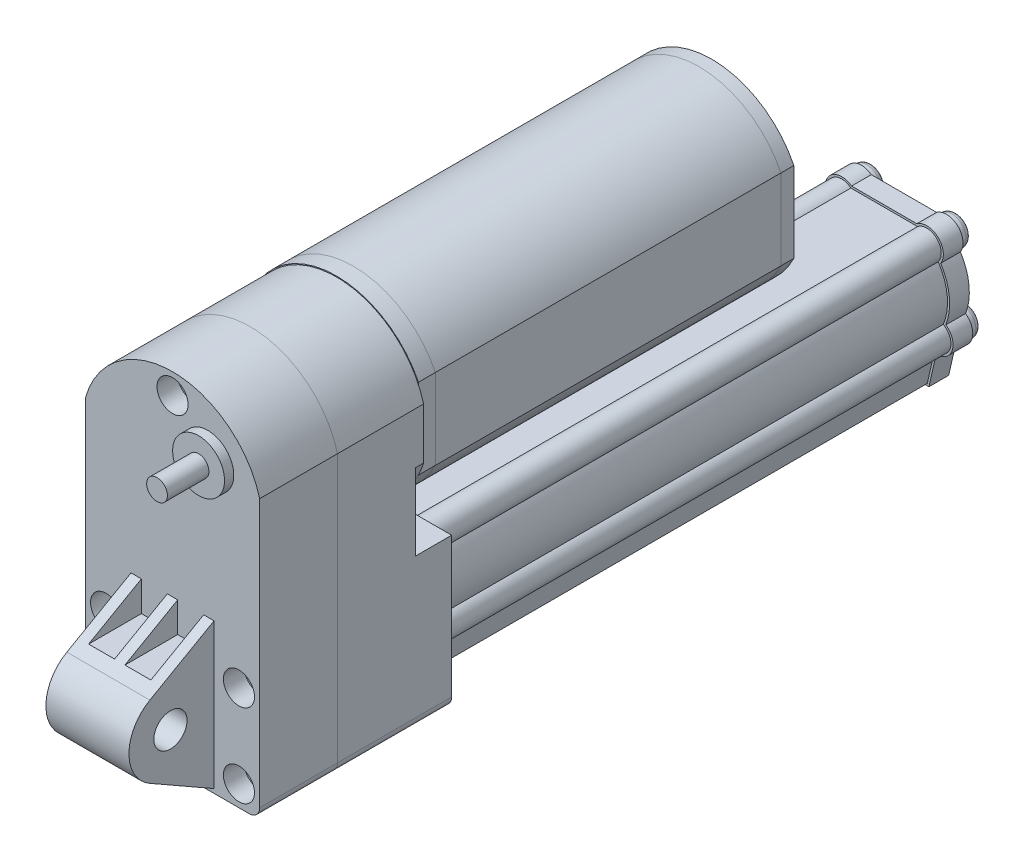
from build123d import *

# Parameters (mm, degrees)
BOSS_EXTRUDE1_DEPTH  = 19.05
SKETCH6_R            = 3.81
CUT_EXTRUDE2_DEPTH   = 5.08
SKETCH12_R           = 3.81
CUT_EXTRUDE3_DEPTH   = 5.08
BOSS_EXTRUDE11_DEPTH = 27.94
CUT_EXTRUDE4_DEPTH   = 8.89
CUT_EXTRUDE5_START   = -6.858
CUT_EXTRUDE5_DEPTH   = 6.858
BOSS_EXTRUDE13_DEPTH = 4.1402
BOSS_EXTRUDE14_DEPTH = 84.582
BOSS_EXTRUDE16_DEPTH = 3.1496
SKETCH26_R           = 11.938
BOSS_EXTRUDE17_DEPTH = 2.54
SKETCH27_R           = 11.938
BOSS_EXTRUDE20_DEPTH = 3.429
CHAMFER1_SIZE        = 2.286
FILLET11_R           = 2.54
CUT_EXTRUDE6_START   = -2.794
CUT_EXTRUDE6_DEPTH   = 2.794
BOSS_EXTRUDE21_DEPTH = 130
BOSS_EXTRUDE23_DEPTH = 4.826
SKETCH32_R           = 9.398
BOSS_EXTRUDE24_DEPTH = 8.128
SKETCH43_R           = 3.556
BOSS_EXTRUDE26_DEPTH = 2.54
FILLET13_R           = 1.27
SKETCH44_R           = 6.35
BOSS_EXTRUDE27_DEPTH = 2.2606
SKETCH45_R           = 2.54
BOSS_EXTRUDE28_DEPTH = 10.16
BOSS_EXTRUDE29_START = -11.176
SKETCH3_R            = 4.064
BOSS_EXTRUDE29_DEPTH = 20.32
SKETCH46_W           = 6.35
SKETCH46_H           = 7.366
CUT_EXTRUDE9_DEPTH   = 20.32
MOVE_START           = -1.75482957
MOVE_FACE1_DEPTH     = 20.32
MOVE_START_2         = 0.78517043
MOVE_FACE1_2_DEPTH   = 6.35
MOVE_START_3         = 9.67517043
MOVE_FACE1_3_DEPTH   = 6.35
MOVE_FACE1_4_DEPTH   = 20.32
MOVE_FACE1_5_DEPTH   = 2.54
MOVE_START_4         = 7.13517043
MOVE_FACE1_6_DEPTH   = 2.54
MOVE_START_5         = 16.02517043
MOVE_FACE1_7_DEPTH   = 2.54
FILLET14_R           = 2.54
FILLET15_R           = 2.54
SKETCH34_R           = 9.398
CUT_EXTRUDE11_DEPTH  = 185.928


# Read off the part's stored shape, not the designer's step: Cut-Extrude6, Move Face1
with BuildPart() as part:
    # Sketch1 → Boss-Extrude1 (new body)
    with BuildSketch(Plane.XY):
        with BuildLine():
            Line((-12.93082957, -18.491086285), (29.74117043, -18.491086285))
            Line((29.74117043, -18.491086285), (29.74117043, 49.580913715))
            ThreePointArc((29.74117043, 49.580913715), (8.40517043, 65.836892729), (-12.93082957, 49.580913715))
            Line((-12.93082957, 49.580913715), (-12.93082957, -18.491086285))
        make_face()
    extrude(amount=-BOSS_EXTRUDE1_DEPTH)

    # Sketch6 → Cut-Extrude2 (cut)
    with BuildSketch(Plane.XY):
        with Locations((-7.85082957, 6.908913715)):
            Circle(SKETCH6_R)
        with Locations((-7.85082957, -13.411086285)):
            Circle(SKETCH6_R)
        with Locations((24.66117043, 6.908913715)):
            Circle(SKETCH6_R)
        with Locations((24.66117043, -13.411086285)):
            Circle(SKETCH6_R)
    extrude(amount=-CUT_EXTRUDE2_DEPTH, mode=Mode.SUBTRACT)

    # Sketch12 → Cut-Extrude3 (cut)
    with BuildSketch(Plane.XY):
        with Locations((8.40517043, 60.756892729)):
            Circle(SKETCH12_R)
    extrude(amount=-CUT_EXTRUDE3_DEPTH, mode=Mode.SUBTRACT)

    # Sketch44 → Boss-Extrude27 (add)
    with BuildSketch(Plane.XY):
        with Locations(Location((17.04117043, 51.358913715, 0), (0, 0, 180))):
            Circle(SKETCH44_R)
    extrude(amount=BOSS_EXTRUDE27_DEPTH)

    # Sketch45 → Boss-Extrude28 (add)
    with BuildSketch(Plane.XY.offset(2.2606)):
        with Locations((17.04117043, 51.358913715)):
            Circle(SKETCH45_R)
    extrude(amount=BOSS_EXTRUDE28_DEPTH)

    # Sketch3 → Boss-Extrude29 (add)
    with BuildSketch(Plane.ZY.offset(12.93082957).offset(BOSS_EXTRUDE29_START)):
        with BuildLine():
            Line((0, -16.662286285), (0, 1.117779576))
            Line((0, 1.117779576), (0, 18.897713715))
            Line((0, 18.897713715), (15.701246407, 9.943459406))
            ThreePointArc((15.701246407, 9.943459406), (20.828056876, 1.117811735), (15.701302277, -7.70786839))
            Line((15.701302277, -7.70786839), (0, -16.662286285))
        make_face()
        with Locations((10.668054799, 1.117779576)):
            Circle(SKETCH3_R, mode=Mode.SUBTRACT)
    extrude(amount=-BOSS_EXTRUDE29_DEPTH)

    # Sketch46 → Cut-Extrude9 (cut)
    with BuildSketch(Plane.XY):
        with Locations((3.96017043, 15.214713715)):
            Rectangle(SKETCH46_W, SKETCH46_H)
        with Locations((12.85017043, 15.214713715)):
            Rectangle(SKETCH46_W, SKETCH46_H)
        with Locations((3.96017043, -12.979286285)):
            Rectangle(SKETCH46_W, SKETCH46_H)
        with Locations((12.85017043, -12.979286285)):
            Rectangle(SKETCH46_W, SKETCH46_H)
    extrude(amount=CUT_EXTRUDE9_DEPTH, mode=Mode.SUBTRACT)

    # Move Face1 outline → Move Face1 (cut)
    with BuildSketch(Plane.YZ.offset(MOVE_START)):
        with BuildLine():
            Line((9.140819406, 15.701246407), (18.095073715, 0))
            Line((18.095073715, 0), (18.897713715, 0))
            Line((18.897713715, 0), (9.943459406, 15.701246407))
            ThreePointArc((9.943459406, 15.701246407), (6.046592425, 19.552448201), (0.716459577, 20.820127714))
            ThreePointArc((0.716459577, 20.820127714), (5.591039303, 19.350826493), (9.140819406, 15.701246407))
        make_face()
        with BuildLine():
            ThreePointArc((0.716459576, 6.623918518), (-2.946220424, 10.668054799), (0.716459576, 14.71219108))
            ThreePointArc((0.716459576, 14.71219108), (-3.748860424, 10.668054799), (0.716459576, 6.623918518))
        make_face()
    extrude(amount=MOVE_FACE1_DEPTH, mode=Mode.SUBTRACT)

    # Move Face1 2 outline → Move Face1 2 (cut)
    with BuildSketch(Plane.YZ.offset(MOVE_START_2)):
        Polygon((11.531713715, 11.508823522), (10.729073716, 12.916249308), (10.729073715, 0), (11.531713715, 0), align=None)
    extrude(amount=MOVE_FACE1_2_DEPTH, mode=Mode.SUBTRACT)

    # Move Face1 3 outline → Move Face1 3 (cut)
    with BuildSketch(Plane.YZ.offset(MOVE_START_3)):
        Polygon((11.531713715, 11.508823522), (10.729073716, 12.916249308), (10.729073715, 0), (11.531713715, 0), align=None)
    extrude(amount=MOVE_FACE1_3_DEPTH, mode=Mode.SUBTRACT)

    # Move Face1 4 outline → Move Face1 4 (add)
    with BuildSketch(Plane.YZ.offset(MOVE_START)):
        with BuildLine():
            ThreePointArc((-7.70786839, 15.701302277), (-4.158092666, 19.350843192), (0.716459577, 20.820127714))
            ThreePointArc((0.716459577, 20.820127714), (-4.61364515, 19.552463801), (-8.51050839, 15.701302277))
            Line((-8.51050839, 15.701302277), (-10.098926285, 12.916059306))
            Line((-10.098926285, 12.916059306), (-10.098926285, 0))
            Line((-10.098926285, 0), (-9.296286285, 0))
            Line((-9.296286285, 0), (-9.296286285, 12.916059306))
            Line((-9.296286285, 12.916059306), (-7.70786839, 15.701302277))
        make_face()
        with BuildLine():
            ThreePointArc((0.716459576, 14.71219108), (4.379139576, 10.668054799), (0.716459576, 6.623918518))
            ThreePointArc((0.716459576, 6.623918518), (5.181779576, 10.668054799), (0.716459576, 14.71219108))
        make_face()
    extrude(amount=MOVE_FACE1_4_DEPTH)

    # Move Face1 5 outline → Move Face1 5 (add)
    with BuildSketch(Plane.YZ.offset(MOVE_START)):
        Polygon((-10.098926285, 11.508654222), (-10.098926285, 12.916059306), (-17.464926285, 0), (-16.662286285, 0), align=None)
    extrude(amount=MOVE_FACE1_5_DEPTH)

    # Move Face1 6 outline → Move Face1 6 (add)
    with BuildSketch(Plane.YZ.offset(MOVE_START_4)):
        Polygon((-10.098926285, 11.508654222), (-10.098926285, 12.916059306), (-17.464926285, 0), (-16.662286285, 0), align=None)
    extrude(amount=MOVE_FACE1_6_DEPTH)

    # Move Face1 7 outline → Move Face1 7 (add)
    with BuildSketch(Plane.YZ.offset(MOVE_START_5)):
        Polygon((-10.098926285, 11.508654222), (-10.098926285, 12.916059306), (-17.464926285, 0), (-16.662286285, 0), align=None)
    extrude(amount=MOVE_FACE1_7_DEPTH)

    # Fillet14
    fillet14_edges = [part.edges().sort_by_distance(p)[0] for p in [
        (29.74117043, -18.491086285, -9.525),
        (-12.93082957, -18.491086285, -9.525),
    ]]
    fillet(fillet14_edges, radius=FILLET14_R)


with BuildPart() as body_2:
    # Sketch17 → Boss-Extrude11 (new body)
    with BuildSketch(Plane(origin=(0, 0, -19.05), x_dir=(-1, 0, 0), z_dir=(0, 0, -1))):
        with BuildLine():
            Line((12.93082957, -18.491086285), (-29.74117043, -18.491086285))
            Line((-29.74117043, -18.491086285), (-29.74117043, 49.580913715))
            ThreePointArc((-29.74117043, 49.580913715), (-8.40517043, 65.836892729), (12.93082957, 49.580913715))
            Line((12.93082957, 49.580913715), (12.93082957, -18.491086285))
        make_face()
    extrude(amount=BOSS_EXTRUDE11_DEPTH)

    # Sketch18 → Cut-Extrude4 (cut)
    with BuildSketch(Plane(origin=(0, 0, -46.99), x_dir=(-1, 0, 0), z_dir=(0, 0, -1))):
        with BuildLine():
            Line((-29.74117043, 18.338913715), (12.93082957, 18.338913715))
            Line((12.93082957, 18.338913715), (12.93082957, 37.044777605))
            ThreePointArc((12.93082957, 37.044777605), (-8.40517043, 21.355135146), (-29.74117043, 37.044777605))
            Line((-29.74117043, 37.044777605), (-29.74117043, 18.338913715))
        make_face()
    extrude(amount=-CUT_EXTRUDE4_DEPTH, mode=Mode.SUBTRACT)

    # Sketch18<5> → Cut-Extrude5 (cut)
    with BuildSketch(Plane(origin=(0, 0, -46.99), x_dir=(-1, 0, 0), z_dir=(0, 0, -1)).offset(CUT_EXTRUDE5_START)):
        with BuildLine():
            Line((12.93082957, 49.580913715), (12.93082957, 37.044777605))
            ThreePointArc((12.93082957, 37.044777605), (13.691369751, 40.337444359), (13.94682957, 43.707135146))
            ThreePointArc((13.94682957, 43.707135146), (-11.774861217, 65.803675328), (-29.74117043, 37.044777605))
            Line((-29.74117043, 37.044777605), (-29.74117043, 49.580913715))
            ThreePointArc((-29.74117043, 49.580913715), (-8.40517043, 65.836892729), (12.93082957, 49.580913715))
        make_face()
        with BuildLine():
            ThreePointArc((-29.74117043, 37.044777605), (-8.40517043, 21.355135146), (12.93082957, 37.044777605))
            Line((12.93082957, 37.044777605), (12.93082957, 49.580913715))
            ThreePointArc((12.93082957, 49.580913715), (-8.40517043, 65.836892729), (-29.74117043, 49.580913715))
            Line((-29.74117043, 49.580913715), (-29.74117043, 37.044777605))
        make_face()
    extrude(amount=CUT_EXTRUDE5_DEPTH, mode=Mode.SUBTRACT)

    # Cut-Extrude6 outline → Cut-Extrude6 (cut)
    with BuildSketch(Plane(origin=(0, 0, -46.99), x_dir=(-1, 0, 0), z_dir=(0, 0, -1)).offset(CUT_EXTRUDE6_START)):
        with BuildLine():
            ThreePointArc((-16.567972961, 13.571054992), (-21.299133174, 13.349170074), (-21.61317043, 8.623232021))
            ThreePointArc((-21.61317043, 8.623232021), (-23.83485908, 2.454274355), (-22.858312088, -4.029420203))
            ThreePointArc((-22.858312088, -4.029420203), (-24.684009124, -7.803496663), (-21.646586083, -10.693286285))
            Line((-21.646586083, -10.693286285), (-20.72417043, -10.693286285))
            Line((-20.72417043, -10.693286285), (-18.94617043, -18.491086285))
            Line((-18.94617043, -18.491086285), (2.13582957, -18.491086285))
            Line((2.13582957, -18.491086285), (3.91382957, -10.693286285))
            ThreePointArc((3.91382957, -10.693286285), (7.761606127, -8.251890338), (6.047971228, -4.029420203))
            ThreePointArc((6.047971228, -4.029420203), (6.826033776, -1.49449173), (7.08882957, 1.144102983))
            Line((7.08882957, 1.144102983), (7.088819872, 1.160210788))
            ThreePointArc((7.088819872, 1.160210788), (6.502214683, 5.062148637), (4.80282957, 8.623232021))
            ThreePointArc((4.80282957, 8.623232021), (4.488792314, 13.349170074), (-0.242367899, 13.571054992))
            Line((-0.242367899, 13.571054992), (-16.567972961, 13.571054992))
        make_face()
    extrude(amount=CUT_EXTRUDE6_DEPTH, mode=Mode.SUBTRACT)

    # Fillet15
    fillet15_edges = [body_2.edges().sort_by_distance(p)[0] for p in [
        (-12.93082957, -18.491086285, -33.02),
        (29.74117043, -18.491086285, -33.02),
    ]]
    fillet(fillet15_edges, radius=FILLET15_R)


with BuildPart() as body_3:
    # Sketch23 → Boss-Extrude13 (new body)
    with BuildSketch(Plane(origin=(0, 0, -40.132), x_dir=(-1, 0, 0), z_dir=(0, 0, -1))):
        with BuildLine():
            Line((11.66082957, 43.707135146), (11.66082957, 33.859924983))
            ThreePointArc((11.66082957, 33.859924983), (-8.40517043, 21.355135146), (-28.47117043, 33.859924983))
            Line((-28.47117043, 33.859924983), (-28.47117043, 43.707135146))
            Line((-28.47117043, 43.707135146), (-28.47117043, 53.554345309))
            ThreePointArc((-28.47117043, 53.554345309), (-8.40517043, 66.059135146), (11.66082957, 53.554345309))
            Line((11.66082957, 53.554345309), (11.66082957, 43.707135146))
        make_face()
    extrude(amount=BOSS_EXTRUDE13_DEPTH)


with BuildPart() as body_4:
    # Sketch24 → Boss-Extrude14 (new body)
    with BuildSketch(Plane(origin=(0, 0, -44.2722), x_dir=(-1, 0, 0), z_dir=(0, 0, -1))):
        with BuildLine():
            Line((11.66082957, 33.859924983), (11.66082957, 53.554345309))
            ThreePointArc((11.66082957, 53.554345309), (-8.40517043, 66.059135146), (-28.47117043, 53.554345309))
            Line((-28.47117043, 53.554345309), (-28.47117043, 33.859924983))
            ThreePointArc((-28.47117043, 33.859924983), (-8.40517043, 21.355135146), (11.66082957, 33.859924983))
        make_face()
    extrude(amount=BOSS_EXTRUDE14_DEPTH)


with BuildPart() as body_5:
    # Sketch25 → Boss-Extrude16 (new body)
    with BuildSketch(Plane(origin=(0, 0, -128.8542), x_dir=(-1, 0, 0), z_dir=(0, 0, -1))):
        with BuildLine():
            Line((11.66082957, 33.859924983), (11.66082957, 53.554345309))
            ThreePointArc((11.66082957, 53.554345309), (-8.40517043, 66.059135146), (-28.47117043, 53.554345309))
            Line((-28.47117043, 53.554345309), (-28.47117043, 33.859924983))
            ThreePointArc((-28.47117043, 33.859924983), (-8.40517043, 21.355135146), (11.66082957, 33.859924983))
        make_face()
    extrude(amount=BOSS_EXTRUDE16_DEPTH)

    # Sketch26 → Boss-Extrude17 (add)
    with BuildSketch(Plane(origin=(0, 0, -132.0038), x_dir=(-1, 0, 0), z_dir=(0, 0, -1))):
        with Locations((-8.40517043, 43.707135146)):
            Circle(SKETCH26_R)
    extrude(amount=BOSS_EXTRUDE17_DEPTH)


with BuildPart() as body_6:
    # Sketch27 → Boss-Extrude20 (new body)
    with BuildSketch(Plane(origin=(0, 0, -134.5438), x_dir=(-1, 0, 0), z_dir=(0, 0, -1))):
        with Locations((-8.40517043, 43.707135146)):
            Circle(SKETCH27_R)
    extrude(amount=BOSS_EXTRUDE20_DEPTH)

    # Chamfer1
    chamfer1_edges = [body_6.edges().sort_by_distance(p)[0] for p in [
        (20.34317043, 43.707135146, -137.9728),
    ]]
    chamfer(chamfer1_edges, length=CHAMFER1_SIZE)

    # Fillet11
    fillet11_edges = [body_6.edges().sort_by_distance(p)[0] for p in [
        (20.34317043, 43.707135146, -135.6868),
    ]]
    fillet(fillet11_edges, radius=FILLET11_R)


with BuildPart() as body_7:
    # Sketch30 → Boss-Extrude21 (new body)
    with BuildSketch(Plane(origin=(0, 0, -44.196), x_dir=(-1, 0, 0), z_dir=(0, 0, -1))):
        with BuildLine():
            Line((-20.72417043, -10.693286285), (-18.94617043, -18.491086285))
            Line((-18.94617043, -18.491086285), (2.13582957, -18.491086285))
            Line((2.13582957, -18.491086285), (3.91382957, -10.693286285))
            ThreePointArc((3.91382957, -10.693286285), (7.761606127, -8.251890338), (6.047971228, -4.029420203))
            ThreePointArc((6.047971228, -4.029420203), (7.024528052, 2.454275322), (4.80282957, 8.623232021))
            ThreePointArc((4.80282957, 8.623232021), (4.488792314, 13.349170074), (-0.242367899, 13.571054992))
            Line((-0.242367899, 13.571054992), (-16.567972961, 13.571054992))
            ThreePointArc((-16.567972961, 13.571054992), (-21.299133174, 13.349170074), (-21.61317043, 8.623232021))
            ThreePointArc((-21.61317043, 8.623232021), (-23.83485908, 2.454274355), (-22.858312088, -4.029420203))
            ThreePointArc((-22.858312088, -4.029420203), (-24.571946987, -8.251890338), (-20.72417043, -10.693286285))
        make_face()
    extrude(amount=BOSS_EXTRUDE21_DEPTH)


with BuildPart() as body_8:
    # Sketch31 → Boss-Extrude23 (new body)
    with BuildSketch(Plane(origin=(0, 0, -174.196), x_dir=(-1, 0, 0), z_dir=(0, 0, -1))):
        with BuildLine():
            Line((-0.415899, 14.079054992), (-16.394441861, 14.079054992))
            ThreePointArc((-16.394441861, 14.079054992), (-21.588241548, 13.775696815), (-22.227712388, 8.612494473))
            ThreePointArc((-22.227712388, 8.612494473), (-24.336184911, 2.546364848), (-23.489636452, -3.819712493))
            ThreePointArc((-23.489636452, -3.819712493), (-25.056721349, -8.403768093), (-21.122639806, -11.230837818))
            Line((-21.122639806, -11.230837818), (-19.351377941, -18.999086285))
            Line((-19.351377941, -18.999086285), (2.54103708, -18.999086285))
            Line((2.54103708, -18.999086285), (4.312298946, -11.230837818))
            ThreePointArc((4.312298946, -11.230837818), (8.246380489, -8.403768093), (6.679295591, -3.819712493))
            ThreePointArc((6.679295591, -3.819712493), (7.52584405, 2.546364848), (5.417371527, 8.612494473))
            ThreePointArc((5.417371527, 8.612494473), (4.777900687, 13.775696815), (-0.415899, 14.079054992))
        make_face()
    extrude(amount=BOSS_EXTRUDE23_DEPTH)



with BuildPart() as body_9:
    # Sketch32 → Boss-Extrude24 (new body)
    with BuildSketch(Plane(origin=(0, 0, -179.022), x_dir=(-1, 0, 0), z_dir=(0, 0, -1))):
        with Locations((-8.40517043, 0.312983004)):
            Circle(SKETCH32_R)
    extrude(amount=BOSS_EXTRUDE24_DEPTH)


with BuildPart() as body_8_1:
    add(body_8.part)

    add(body_9.part)  # Boss-Extrude26 merges body 9
    # Sketch43 → Boss-Extrude26 (add)
    with BuildSketch(Plane(origin=(0, 0, -179.022), x_dir=(-1, 0, 0), z_dir=(0, 0, -1))):
        with Locations((-18.809281307, 10.810317247)):
            Circle(SKETCH43_R)
        with Locations((1.998940446, 10.810317247)):
            Circle(SKETCH43_R)
        with Locations((-21.185378257, -7.167322113)):
            Circle(SKETCH43_R)
        with Locations((4.375037396, -7.167322113)):
            Circle(SKETCH43_R)
    extrude(amount=BOSS_EXTRUDE26_DEPTH)

    # Fillet13
    fillet13_edges = [body_8_1.edges().sort_by_distance(p)[0] for p in [
        (22.365281307, 10.810317247, -181.562),
        (1.557059554, 10.810317247, -181.562),
        (24.741378257, -7.167322113, -181.562),
        (-0.819037396, -7.167322113, -181.562),
    ]]
    fillet(fillet13_edges, radius=FILLET13_R)


with BuildPart() as cut_extrude11_tool:
    # Sketch34 → Cut-Extrude11 (new body)
    with BuildSketch(Plane(origin=(0, 0, -187.15), x_dir=(-1, 0, 0), z_dir=(0, 0, -1))):
        with Locations((-8.40517043, 0.312983004)):
            Circle(SKETCH34_R)
    extrude(amount=-CUT_EXTRUDE11_DEPTH)


with BuildPart() as body_7_1:
    add(body_7.part)

    # Cut-Extrude11: cut by cut_extrude11_tool
    add(cut_extrude11_tool.part, mode=Mode.SUBTRACT)


with BuildPart() as body_8_2:
    add(body_8_1.part)

    # Cut-Extrude11: cut by cut_extrude11_tool
    add(cut_extrude11_tool.part, mode=Mode.SUBTRACT)


solid = Compound([part.part, body_2.part, body_3.part, body_4.part, body_5.part, body_6.part, body_7_1.part, body_8_2.part])
